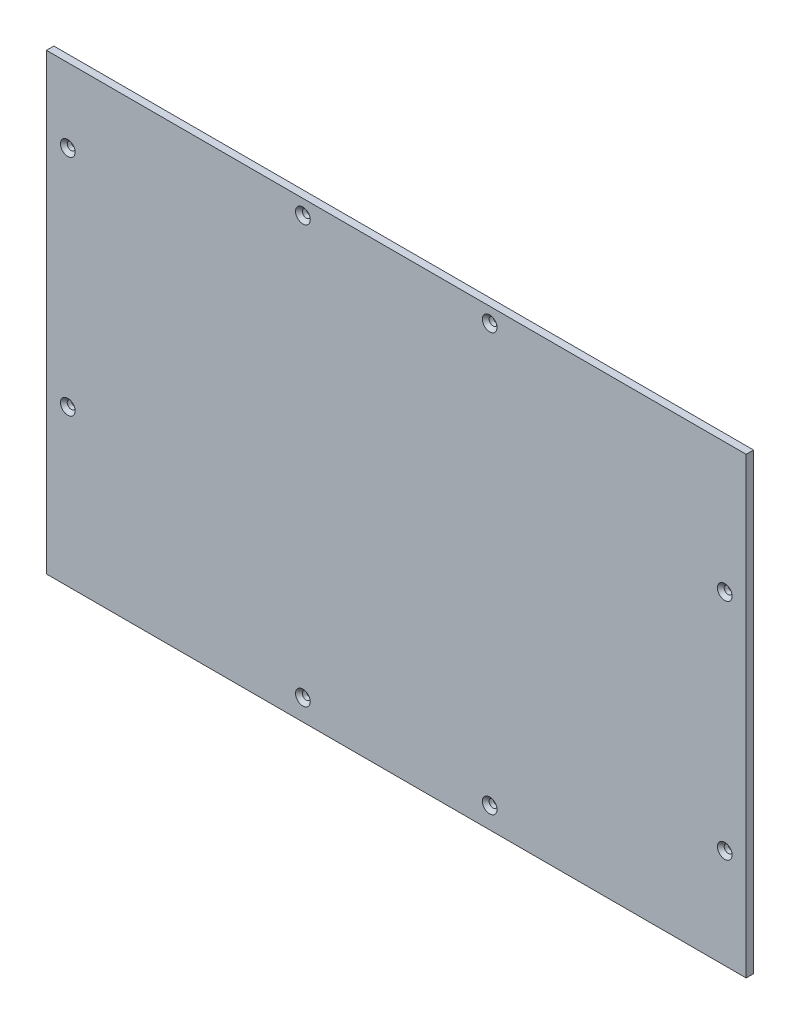
from build123d import *

# Parameters (mm, degrees)
SKETCH1_W                                       = 299.7
SKETCH1_H                                       = 194.25
BOSS_EXTRUDE1_DEPTH                             = 3.175
CSK_FOR_M3_FLAT_HEAD_MACHINE_SCREW1_D           = 3.4
CSK_FOR_M3_FLAT_HEAD_MACHINE_SCREW1_CSINK_D     = 6.3
CSK_FOR_M3_FLAT_HEAD_MACHINE_SCREW1_CSINK_ANGLE = 90


with BuildPart() as part:
    # Sketch1 → Boss-Extrude1 (new body)
    with BuildSketch(Plane.XY):
        Rectangle(SKETCH1_W, SKETCH1_H)
    extrude(amount=BOSS_EXTRUDE1_DEPTH)

    # CSK for M3 Flat Head Machine Screw1 (through all)
    with Locations(Plane.XY.offset(3.175)):
        with Locations((40, 90.775000052), (140.687500033, 41.475000052), (140.687500033, -54.524999948), (-40, -88.030749948), (40, -88.030749948), (-140.687500033, -30.524999948), (-140.687500033, 65.475000052), (-40, 90.775000052)):
            CounterSinkHole(CSK_FOR_M3_FLAT_HEAD_MACHINE_SCREW1_D / 2, CSK_FOR_M3_FLAT_HEAD_MACHINE_SCREW1_CSINK_D / 2, counter_sink_angle=CSK_FOR_M3_FLAT_HEAD_MACHINE_SCREW1_CSINK_ANGLE)


solid = part.part
